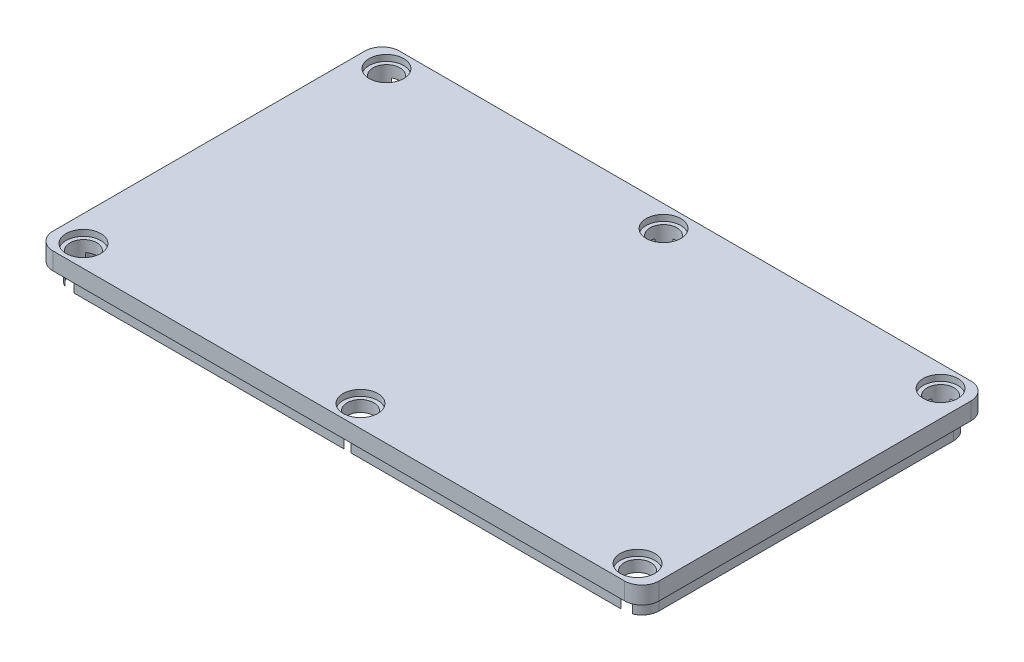
from build123d import *

# Parameters (mm, degrees)
BOSS_EXTRUDE1_DEPTH  = 2
BOSS_EXTRUDE2_DEPTH  = 2
SKETCH3_R            = 2
SKETCH3_R_2          = 1.5
CUT_EXTRUDE1_DEPTH   = 0.7
SKETCH8_R            = 1.55
CUT_EXTRUDE7_DEPTH   = 7
LPATTERN1_COUNT      = 3
LPATTERN1_PITCH      = 32
LPATTERN1_COUNT_DIR2 = 2
LPATTERN1_PITCH_DIR2 = 35


with BuildPart() as part:
    # Sketch1 → Boss-Extrude1 (new body)
    with BuildSketch(Plane(origin=(0, 0, 0), x_dir=(1, 0, 0), z_dir=(0, 1, 0))):
        with BuildLine():
            Line((-33, -20), (33, -20))
            ThreePointArc((33, -20), (34.414213562, -19.414213562), (35, -18))
            Line((35, -18), (35, 18))
            ThreePointArc((35, 18), (34.414213562, 19.414213562), (33, 20))
            Line((33, 20), (-33, 20))
            ThreePointArc((-33, 20), (-34.414213562, 19.414213562), (-35, 18))
            Line((-35, 18), (-35, -18))
            ThreePointArc((-35, -18), (-34.414213562, -19.414213562), (-33, -20))
        make_face()
    extrude(amount=BOSS_EXTRUDE1_DEPTH)

    # Sketch2 → Boss-Extrude2 (add)
    with BuildSketch(Plane.XZ):
        with BuildLine():
            Line((32, -19), (-32, -19))
            ThreePointArc((-32, -19), (-33.414213562, -18.414213562), (-34, -17))
            Line((-34, -17), (-34, 17))
            ThreePointArc((-34, 17), (-33.414213562, 18.414213562), (-32, 19))
            Line((-32, 19), (32, 19))
            ThreePointArc((32, 19), (33.414213562, 18.414213562), (34, 17))
            Line((34, 17), (34, -17))
            ThreePointArc((34, -17), (33.414213562, -18.414213562), (32, -19))
        make_face()
        with BuildLine():
            Line((31, -18), (-31, -18))
            ThreePointArc((-31, -18), (-32.414213562, -17.414213562), (-33, -16))
            Line((-33, -16), (-33, 16))
            ThreePointArc((-33, 16), (-32.414213562, 17.414213562), (-31, 18))
            Line((-31, 18), (31, 18))
            ThreePointArc((31, 18), (32.414213562, 17.414213562), (33, 16))
            Line((33, 16), (33, -16))
            ThreePointArc((33, -16), (32.414213562, -17.414213562), (31, -18))
        make_face(mode=Mode.SUBTRACT)
    extrude(amount=BOSS_EXTRUDE2_DEPTH)

    # Sketch3 → Cut-Extrude1 (cut)
    # profile 1 of 6: a face of its own
    with BuildSketch(Plane(origin=(0, 2, 0), x_dir=(1, 0, 0), z_dir=(0, 1, 0))):
        with Locations((-32, 17.5)):
            Circle(SKETCH3_R)
        with Locations((-32, 17.5)):
            Circle(SKETCH3_R_2, mode=Mode.SUBTRACT)
    # profile 2 of 6: a face of its own
    with BuildSketch(Plane(origin=(0, 2, 0), x_dir=(1, 0, 0), z_dir=(0, 1, 0))):
        with Locations((0, 17.5)):
            Circle(SKETCH3_R)
        with Locations((0, 17.5)):
            Circle(SKETCH3_R_2, mode=Mode.SUBTRACT)
    # profile 3 of 6: a face of its own
    with BuildSketch(Plane(origin=(0, 2, 0), x_dir=(1, 0, 0), z_dir=(0, 1, 0))):
        with Locations((32, 17.5)):
            Circle(SKETCH3_R)
        with Locations((32, 17.5)):
            Circle(SKETCH3_R_2, mode=Mode.SUBTRACT)
    # profile 4 of 6: a face of its own
    with BuildSketch(Plane(origin=(0, 2, 0), x_dir=(1, 0, 0), z_dir=(0, 1, 0))):
        with Locations((32, -17.5)):
            Circle(SKETCH3_R)
        with Locations((32, -17.5)):
            Circle(SKETCH3_R_2, mode=Mode.SUBTRACT)
    # profile 5 of 6: a face of its own
    with BuildSketch(Plane(origin=(0, 2, 0), x_dir=(1, 0, 0), z_dir=(0, 1, 0))):
        with Locations((0, -17.5)):
            Circle(SKETCH3_R)
        with Locations((0, -17.5)):
            Circle(SKETCH3_R_2, mode=Mode.SUBTRACT)
    # profile 6 of 6: a face of its own
    with BuildSketch(Plane(origin=(0, 2, 0), x_dir=(1, 0, 0), z_dir=(0, 1, 0))):
        with Locations((-32, -17.5)):
            Circle(SKETCH3_R)
        with Locations((-32, -17.5)):
            Circle(SKETCH3_R_2, mode=Mode.SUBTRACT)
    extrude(amount=-CUT_EXTRUDE1_DEPTH, mode=Mode.SUBTRACT)

    # Sketch8 → Cut-Extrude7 (cut)
    with BuildSketch(Plane(origin=(0, 2, 0), x_dir=(1, 0, 0), z_dir=(0, 1, 0))):
        with Locations((-32, 17.5)):
            Circle(SKETCH8_R)
    cut_extrude7 = extrude(amount=-CUT_EXTRUDE7_DEPTH, mode=Mode.SUBTRACT)

    # LPattern1: Cut-Extrude7 3 × 2
    with Locations(*[(i * LPATTERN1_PITCH, 0, j * LPATTERN1_PITCH_DIR2) for i in range(LPATTERN1_COUNT) for j in range(LPATTERN1_COUNT_DIR2) if (i, j) != (0, 0)]):
        add(cut_extrude7, mode=Mode.SUBTRACT)


solid = part.part
